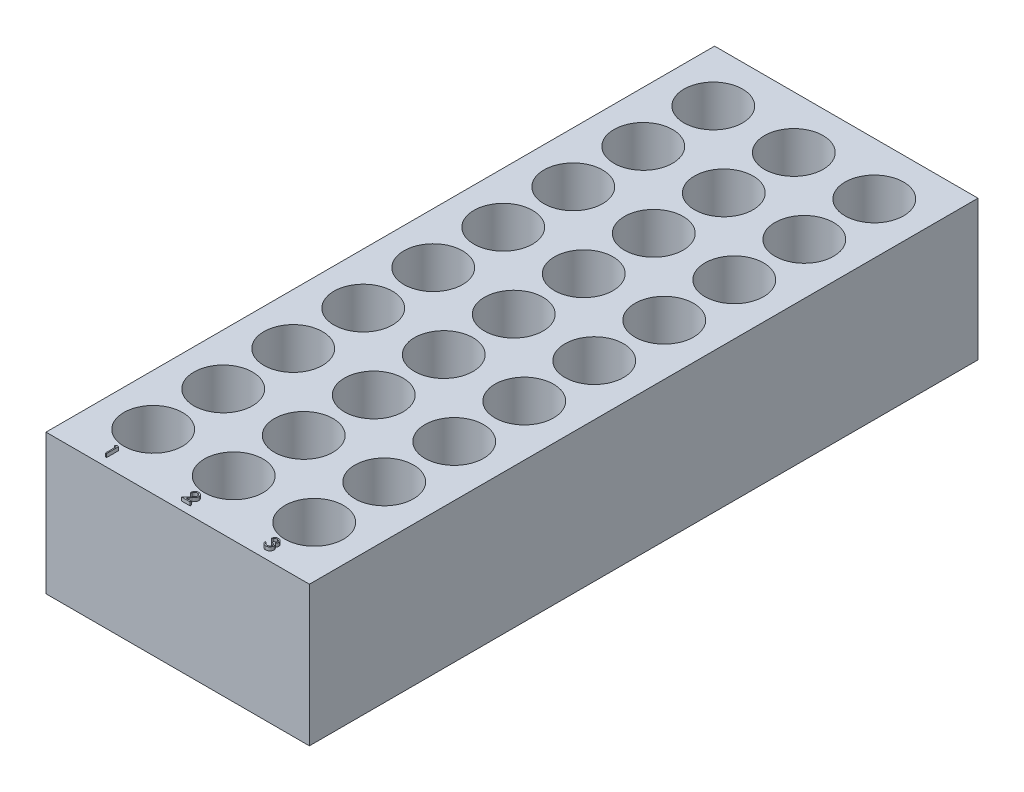
from build123d import *

# Parameters (mm, degrees)
SKETCH1_W           = 75.25
SKETCH1_H           = 191
SKETCH1_R           = 8.375
BOSS_EXTRUDE1_DEPTH = 30
SKETCH3_W           = 75.25
SKETCH3_H           = 191
BOSS_EXTRUDE2_DEPTH = 10
BOSS_EXTRUDE3_DEPTH = 1


with BuildPart() as part:
    # Sketch1 → Boss-Extrude1 (new body)
    with BuildSketch(Plane(origin=(0, 0, 0), x_dir=(1, 0, 0), z_dir=(0, 1, 0))):
        Rectangle(SKETCH1_W, SKETCH1_H)
        with Locations((-23, 80.5)):
            Circle(SKETCH1_R, mode=Mode.SUBTRACT)
        with Locations((0, 80.5)):
            Circle(SKETCH1_R, mode=Mode.SUBTRACT)
        with Locations((23, 80.5)):
            Circle(SKETCH1_R, mode=Mode.SUBTRACT)
        with Locations((-23, 60.5)):
            Circle(SKETCH1_R, mode=Mode.SUBTRACT)
        with Locations((0, 60.5)):
            Circle(SKETCH1_R, mode=Mode.SUBTRACT)
        with Locations((23, 60.5)):
            Circle(SKETCH1_R, mode=Mode.SUBTRACT)
        with Locations((-23, 40.5)):
            Circle(SKETCH1_R, mode=Mode.SUBTRACT)
        with Locations((0, 40.5)):
            Circle(SKETCH1_R, mode=Mode.SUBTRACT)
        with Locations((23, 40.5)):
            Circle(SKETCH1_R, mode=Mode.SUBTRACT)
        with Locations((-23, 20.5)):
            Circle(SKETCH1_R, mode=Mode.SUBTRACT)
        with Locations((0, 20.5)):
            Circle(SKETCH1_R, mode=Mode.SUBTRACT)
        with Locations((23, 20.5)):
            Circle(SKETCH1_R, mode=Mode.SUBTRACT)
        with Locations((-23, 0.5)):
            Circle(SKETCH1_R, mode=Mode.SUBTRACT)
        with Locations((0, 0.5)):
            Circle(SKETCH1_R, mode=Mode.SUBTRACT)
        with Locations((23, 0.5)):
            Circle(SKETCH1_R, mode=Mode.SUBTRACT)
        with Locations((-23, -19.5)):
            Circle(SKETCH1_R, mode=Mode.SUBTRACT)
        with Locations((0, -19.5)):
            Circle(SKETCH1_R, mode=Mode.SUBTRACT)
        with Locations((23, -19.5)):
            Circle(SKETCH1_R, mode=Mode.SUBTRACT)
        with Locations((-23, -39.5)):
            Circle(SKETCH1_R, mode=Mode.SUBTRACT)
        with Locations((0, -39.5)):
            Circle(SKETCH1_R, mode=Mode.SUBTRACT)
        with Locations((23, -39.5)):
            Circle(SKETCH1_R, mode=Mode.SUBTRACT)
        with Locations((-23, -59.5)):
            Circle(SKETCH1_R, mode=Mode.SUBTRACT)
        with Locations((0, -59.5)):
            Circle(SKETCH1_R, mode=Mode.SUBTRACT)
        with Locations((23, -59.5)):
            Circle(SKETCH1_R, mode=Mode.SUBTRACT)
        with Locations((-23, -79.5)):
            Circle(SKETCH1_R, mode=Mode.SUBTRACT)
        with Locations((0, -79.5)):
            Circle(SKETCH1_R, mode=Mode.SUBTRACT)
        with Locations((23, -79.5)):
            Circle(SKETCH1_R, mode=Mode.SUBTRACT)
    extrude(amount=BOSS_EXTRUDE1_DEPTH)

    # Sketch3 → Boss-Extrude2 (add)
    with BuildSketch(Plane.XZ):
        Rectangle(SKETCH3_W, SKETCH3_H)
    extrude(amount=BOSS_EXTRUDE2_DEPTH)

    # Sketch4 → Boss-Extrude3 (add)
    with BuildSketch(Plane(origin=(0, 30, 0), x_dir=(1, 0, 0), z_dir=(0, 1, 0))):
        Polygon((-23.314698, -89.675295836), (-22.667562584, -89.675295836), (-22.667562584, -93.175295836), (-22.981665148, -93.175295836), (-22.981665148, -90.034270195), (-23.520126686, -90.034270195), align=None)
        with BuildLine():
            Line((-0.725254891, -90.752218913), (-1.039357455, -90.752218913))
            add(Edge.make_bspline(
                [(-1.039357455, -90.752218913), (-1.037310302, -90.710548025), (-1.033289748, -90.628707511), (-1.014461459, -90.509383604), (-0.987520582, -90.395328805), (-0.949429128, -90.287458891), (-0.90212285, -90.184820084), (-0.845392823, -90.087820069), (-0.778198972, -89.99682888), (-0.701992238, -89.912690036), (-0.619223599, -89.835502466), (-0.52991766, -89.768847223), (-0.436072632, -89.712529552), (-0.337973233, -89.66544831), (-0.23451267, -89.630108464), (-0.126629812, -89.603886824), (-0.013850676, -89.588110478), (0.062989347, -89.586414693), (0.102068827, -89.585552246)],
                knots=[0, 0, 0, 0, 1.10065271, 2.161652631, 3.183658789, 4.190468796, 5.17591951, 6.163126047, 7.15150782, 8.156236427, 9.156009102, 10.134482811, 11.092018607, 12.041330605, 13.001268258, 13.972401359, 14.968799086, 16, 16, 16, 16], degree=3))
            add(Edge.make_bspline(
                [(0.102068827, -89.585552246), (0.140446901, -89.586450703), (0.215858445, -89.588216137), (0.32592046, -89.603377167), (0.430697754, -89.627122758), (0.529985521, -89.660438175), (0.622991585, -89.705222602), (0.71041463, -89.759020141), (0.793295441, -89.821239972), (0.867902224, -89.894493786), (0.936410304, -89.97269617), (0.995512559, -90.056184074), (1.046125722, -90.142413359), (1.088313402, -90.232041561), (1.119369541, -90.325912589), (1.142947749, -90.422659792), (1.156275163, -90.523284603), (1.158320586, -90.591391159), (1.159360493, -90.62601699)],
                knots=[0, 0, 0, 0, 1.111607364, 2.184268762, 3.212621178, 4.221274766, 5.211760367, 6.196651075, 7.1921475, 8.207485113, 9.220403448, 10.201281604, 11.166441695, 12.114753415, 13.065576456, 14.026450734, 14.996634279, 16, 16, 16, 16], degree=3))
            add(Edge.make_bspline(
                [(1.159360493, -90.62601699), (1.157667231, -90.674764824), (1.154310419, -90.771405038), (1.125596043, -90.913419901), (1.080749532, -91.05101332), (1.026752175, -91.161750622), (0.972279731, -91.250984116), (0.923192223, -91.324452821), (0.865727412, -91.403558289), (0.799048914, -91.488035626), (0.724536042, -91.578546531), (0.641513879, -91.675036327), (0.549390397, -91.776508097), (0.484731896, -91.845813698), (0.451227481, -91.881726124)],
                knots=[0, 0, 0, 0, 1.184426356, 2.348067706, 3.509069118, 4.696110526, 5.333549288, 6.050745305, 6.844228056, 7.710549037, 8.667450064, 9.695053472, 10.805634456, 12, 12, 12, 12], degree=3))
            Line((0.451227481, -91.881726124), (-0.424473641, -92.816321477))
            Line((-0.424473641, -92.816321477), (1.204232288, -92.816321477))
            Line((1.204232288, -92.816321477), (1.204232288, -93.175295836))
            Line((1.204232288, -93.175295836), (-1.17397284, -93.175295836))
            Line((-1.17397284, -93.175295836), (0.183398955, -91.726778208))
            add(Edge.make_bspline(
                [(0.183398955, -91.726778208), (0.216446842, -91.692279901), (0.279925069, -91.626015715), (0.369707646, -91.529272754), (0.450346634, -91.439523214), (0.522364027, -91.356936665), (0.584197532, -91.280305097), (0.639069764, -91.212110394), (0.683035355, -91.149355944), (0.730750751, -91.07661533), (0.776964732, -90.987803012), (0.816677088, -90.879269323), (0.840891937, -90.767542071), (0.843796772, -90.692040033), (0.845257929, -90.654061862)],
                knots=[0, 0, 0, 0, 1.329631726, 2.553950428, 3.673215718, 4.687767853, 5.603093632, 6.413772471, 7.123043292, 7.734684054, 8.834405432, 9.900288307, 10.943827018, 12, 12, 12, 12], degree=3))
            add(Edge.make_bspline(
                [(0.845257929, -90.654061862), (0.844622187, -90.630180463), (0.843369261, -90.583114813), (0.832311564, -90.514109054), (0.815601057, -90.44754424), (0.791655799, -90.383215621), (0.760049059, -90.321769969), (0.721575679, -90.263132489), (0.677185616, -90.206443523), (0.625834347, -90.153290225), (0.569422827, -90.10460902), (0.509828577, -90.061484934), (0.446778473, -90.025445824), (0.380538351, -89.995902326), (0.311292881, -89.972726945), (0.238908136, -89.956668366), (0.16358412, -89.946585882), (0.112150624, -89.94522171), (0.085943025, -89.944526605)],
                knots=[0, 0, 0, 0, 0.991446411, 1.95395049, 2.89581595, 3.838931463, 4.798493298, 5.75982156, 6.748411868, 7.785213223, 8.824556874, 9.840280684, 10.836137867, 11.835679398, 12.848801643, 13.863922112, 14.911575587, 16, 16, 16, 16], degree=3))
            add(Edge.make_bspline(
                [(0.085943025, -89.944526605), (0.058572193, -89.945241637), (0.004820396, -89.946645843), (-0.074098636, -89.956468507), (-0.149384414, -89.973414347), (-0.221226317, -89.996591022), (-0.289745903, -90.02604957), (-0.354609947, -90.062741315), (-0.415672836, -90.106524808), (-0.473049359, -90.156165364), (-0.525913338, -90.211432966), (-0.572360214, -90.273042929), (-0.612944228, -90.339870344), (-0.648353462, -90.411734895), (-0.677109152, -90.489288675), (-0.699082302, -90.57225638), (-0.716469149, -90.660277761), (-0.72227767, -90.721062846), (-0.725254891, -90.752218913)],
                knots=[0, 0, 0, 0, 1.031018746, 2.02475058, 2.990194455, 3.934040569, 4.864654155, 5.795059489, 6.735614925, 7.690564532, 8.649604399, 9.611025574, 10.590972636, 11.591080095, 12.624614302, 13.701020113, 14.821632451, 16, 16, 16, 16], degree=3))
        make_face()
        with BuildLine():
            Line((22.159360493, -90.482988144), (21.845257929, -90.482988144))
            add(Edge.make_bspline(
                [(21.845257929, -90.482988144), (21.85376748, -90.44775566), (21.870402956, -90.378879035), (21.905100529, -90.280471774), (21.942899784, -90.187348253), (21.988288889, -90.101252179), (22.037797643, -90.020453277), (22.094520365, -89.946784152), (22.155840087, -89.878371187), (22.223665036, -89.817657949), (22.294793698, -89.76268022), (22.370228318, -89.715805163), (22.448451211, -89.67548101), (22.530004344, -89.642260778), (22.615130516, -89.617235254), (22.703060139, -89.599078449), (22.79402364, -89.587287334), (22.85577123, -89.586136571), (22.887124916, -89.585552246)],
                knots=[0, 0, 0, 0, 1.162005537, 2.271625781, 3.343758855, 4.383309926, 5.390229558, 6.379919256, 7.361854164, 8.333198761, 9.295911338, 10.242430842, 11.177959212, 12.116337295, 13.062827104, 14.020064771, 14.994644689, 16, 16, 16, 16], degree=3))
            add(Edge.make_bspline(
                [(22.887124916, -89.585552246), (22.932807659, -89.586931476), (23.023176669, -89.589659852), (23.155939716, -89.614574288), (23.283966536, -89.653999421), (23.405855783, -89.708473148), (23.519074216, -89.775660461), (23.619810403, -89.855625198), (23.706698914, -89.946824499), (23.779593291, -90.047557064), (23.83666829, -90.155212573), (23.878754664, -90.26601273), (23.904376345, -90.379694702), (23.907696902, -90.456451981), (23.909360493, -90.494907214)],
                knots=[0, 0, 0, 0, 1.083050992, 2.142477498, 3.193116406, 4.255571735, 5.30263384, 6.308962982, 7.297363603, 8.282367274, 9.249857812, 10.179914175, 11.08814088, 12, 12, 12, 12], degree=3))
            add(Edge.make_bspline(
                [(23.909360493, -90.494907214), (23.908196902, -90.531914009), (23.905919935, -90.604330563), (23.88658623, -90.71005206), (23.854049967, -90.809693661), (23.808980204, -90.903674823), (23.750638654, -90.991399663), (23.679965957, -91.073065554), (23.596463295, -91.149034712), (23.533184357, -91.192554185), (23.500606487, -91.214959297)],
                knots=[0, 0, 0, 0, 1.024540389, 2.004866551, 2.965041327, 3.920577974, 4.882998113, 5.874504559, 6.905732034, 8, 8, 8, 8], degree=3))
            add(Edge.make_bspline(
                [(23.500606487, -91.214959297), (23.537838242, -91.232937469), (23.611605116, -91.268557427), (23.712155645, -91.338413184), (23.803433521, -91.419069532), (23.85433724, -91.482012184), (23.879913378, -91.513637182)],
                knots=[0, 0, 0, 0, 1.015518401, 2.012035669, 3.001164323, 4, 4, 4, 4], degree=3))
            add(Edge.make_bspline(
                [(23.879913378, -91.513637182), (23.89675472, -91.536694934), (23.930161616, -91.58243285), (23.97139715, -91.655969276), (24.008806264, -91.730320765), (24.037956484, -91.807480171), (24.060530351, -91.886553185), (24.076666383, -91.967675581), (24.086690524, -92.050913604), (24.088126076, -92.107226084), (24.088847673, -92.135532214)],
                knots=[0, 0, 0, 0, 1.025084078, 2.033381695, 3.024893161, 4.013698104, 4.991890475, 5.976764909, 6.982997093, 8, 8, 8, 8], degree=3))
            add(Edge.make_bspline(
                [(24.088847673, -92.135532214), (24.087053159, -92.184541935), (24.083472577, -92.282330737), (24.051468503, -92.426805459), (24.001855262, -92.568030961), (23.931398326, -92.7031058), (23.845530818, -92.829486181), (23.743373493, -92.94256249), (23.626087085, -93.039761095), (23.495281436, -93.120971323), (23.353564308, -93.185889245), (23.201988716, -93.230946688), (23.042738662, -93.260292687), (22.933531364, -93.263439556), (22.878010333, -93.265039426)],
                knots=[0, 0, 0, 0, 0.955779014, 1.907060117, 2.875433937, 3.871313158, 4.872415639, 5.851225146, 6.836215519, 7.83643374, 8.849228613, 9.86973379, 10.916971861, 12, 12, 12, 12], degree=3))
            add(Edge.make_bspline(
                [(22.878010333, -93.265039426), (22.840591033, -93.264171212), (22.766962328, -93.262462858), (22.658718829, -93.250784257), (22.55539713, -93.229454252), (22.456857532, -93.200750946), (22.363012496, -93.164359204), (22.274148391, -93.119040506), (22.189718497, -93.065729004), (22.110519546, -93.003795416), (22.036560978, -92.934514077), (21.969808254, -92.856655067), (21.909148461, -92.771657663), (21.856205822, -92.678534607), (21.80856887, -92.578489349), (21.769387913, -92.470240851), (21.734902344, -92.354756829), (21.71886888, -92.274279089), (21.710642545, -92.232988144)],
                knots=[0, 0, 0, 0, 1.048658725, 2.063410685, 3.046034179, 4.001477787, 4.936774919, 5.862367409, 6.792675028, 7.730719943, 8.675894397, 9.627829632, 10.600096036, 11.597688215, 12.626045268, 13.701542398, 14.82072376, 16, 16, 16, 16], degree=3))
            Line((21.710642545, -92.232988144), (22.024745109, -92.232988144))
            add(Edge.make_bspline(
                [(22.024745109, -92.232988144), (22.0329284, -92.259937157), (22.048845613, -92.312355329), (22.075939911, -92.387795634), (22.106808183, -92.456953687), (22.139922742, -92.520336809), (22.174701188, -92.578569212), (22.213616113, -92.630111081), (22.253785258, -92.677226283), (22.284064611, -92.703770895), (22.298883731, -92.716762182)],
                knots=[0, 0, 0, 0, 1.198163088, 2.33053128, 3.407730985, 4.417276592, 5.372219308, 6.28897303, 7.162600585, 8, 8, 8, 8], degree=3))
            add(Edge.make_bspline(
                [(22.298883731, -92.716762182), (22.318480307, -92.731870516), (22.35761297, -92.762040548), (22.421381201, -92.800542176), (22.488446087, -92.833903202), (22.560260761, -92.859386897), (22.635275532, -92.880964558), (22.714702897, -92.895085077), (22.797842114, -92.904773249), (22.854609878, -92.90562818), (22.883619308, -92.906065067)],
                knots=[0, 0, 0, 0, 0.946170439, 1.889420265, 2.845303464, 3.807233317, 4.801018734, 5.828864929, 6.890507805, 8, 8, 8, 8], degree=3))
            add(Edge.make_bspline(
                [(22.883619308, -92.906065067), (22.91637281, -92.905449161), (22.980419457, -92.904244812), (23.073874316, -92.893169105), (23.162781764, -92.877038692), (23.24615469, -92.852125709), (23.325085197, -92.821344857), (23.398466847, -92.782696452), (23.467262953, -92.73735173), (23.530592358, -92.685812572), (23.587537866, -92.629391077), (23.637677379, -92.570378005), (23.680302041, -92.509022176), (23.714685619, -92.444984055), (23.741836169, -92.378528826), (23.76031937, -92.309469997), (23.773170885, -92.238372731), (23.774217497, -92.190043762), (23.774745109, -92.165680451)],
                knots=[0, 0, 0, 0, 1.217147791, 2.380027433, 3.494444702, 4.572153297, 5.609568379, 6.639424714, 7.649109417, 8.668170816, 9.669597737, 10.625200337, 11.543417969, 12.441394052, 13.322311151, 14.205496177, 15.095365482, 16, 16, 16, 16], degree=3))
            add(Edge.make_bspline(
                [(23.774745109, -92.165680451), (23.773214807, -92.133069112), (23.770161819, -92.068008704), (23.746853239, -91.97229113), (23.708514375, -91.880067717), (23.654841864, -91.792911927), (23.589506135, -91.712136026), (23.513141228, -91.640064543), (23.425113, -91.580594452), (23.344093131, -91.539505796), (23.272327974, -91.511468721), (23.21091259, -91.492793756), (23.142155987, -91.476980101), (23.066889638, -91.462267829), (22.984546421, -91.449746481), (22.895215983, -91.439304665), (22.798880222, -91.430949624), (22.732189056, -91.427218529), (22.697822032, -91.425295836)],
                knots=[0, 0, 0, 0, 1.07054697, 2.135767047, 3.216561865, 4.33974944, 5.486079747, 6.621378074, 7.775625952, 8.963672916, 9.598146892, 10.304877434, 11.070270905, 11.915000392, 12.823868403, 13.805723172, 14.86925407, 16, 16, 16, 16], degree=3))
            Line((22.697822032, -91.425295836), (22.697822032, -91.066321477))
            add(Edge.make_bspline(
                [(22.697822032, -91.066321477), (22.741123198, -91.065586673), (22.825939544, -91.064147373), (22.949833849, -91.046739363), (23.068307161, -91.022658735), (23.178733903, -90.985773543), (23.279382616, -90.942933246), (23.366702218, -90.893081036), (23.439469366, -90.837666287), (23.497330437, -90.775833678), (23.540859666, -90.70951863), (23.572686463, -90.640401972), (23.59148679, -90.567877911), (23.593996456, -90.518383244), (23.595257929, -90.493504971)],
                knots=[0, 0, 0, 0, 1.321986639, 2.589447074, 3.816329219, 5.01088745, 6.139805852, 7.153945165, 8.075214402, 8.924034688, 9.728124013, 10.488707548, 11.240355623, 12, 12, 12, 12], degree=3))
            add(Edge.make_bspline(
                [(23.595257929, -90.493504971), (23.594843518, -90.475227225), (23.594019067, -90.438864518), (23.58362179, -90.38573945), (23.567997749, -90.334238504), (23.546518019, -90.284580693), (23.517767821, -90.23711042), (23.483361834, -90.191422971), (23.442393734, -90.147779192), (23.395448287, -90.107098872), (23.345036482, -90.068329635), (23.289786707, -90.035415998), (23.231364832, -90.007270936), (23.169706177, -89.984061434), (23.104610647, -89.966602146), (23.036384089, -89.954066304), (22.964896406, -89.946228649), (22.916124674, -89.945100233), (22.891331647, -89.944526605)],
                knots=[0, 0, 0, 0, 0.884392785, 1.759457502, 2.611959086, 3.489218968, 4.37281399, 5.2945488, 6.255912374, 7.266815255, 8.301784654, 9.332968512, 10.37626691, 11.440494194, 12.520033166, 13.637162961, 14.798855837, 16, 16, 16, 16], degree=3))
            add(Edge.make_bspline(
                [(22.891331647, -89.944526605), (22.851479979, -89.945917967), (22.773640403, -89.948635621), (22.661425486, -89.972438634), (22.557106152, -90.010416718), (22.477367485, -90.055749737), (22.418484911, -90.100500171), (22.376407973, -90.139582557), (22.335087463, -90.183015381), (22.297241786, -90.233473756), (22.258967809, -90.287540546), (22.224123248, -90.347964228), (22.190263555, -90.413168622), (22.169861006, -90.459264257), (22.159360493, -90.482988144)],
                knots=[0, 0, 0, 0, 1.472543308, 2.876219568, 4.221790263, 5.565193594, 6.249813518, 6.953379497, 7.687249741, 8.463570142, 9.283606569, 10.136032583, 11.040678096, 12, 12, 12, 12], degree=3))
        make_face()
    extrude(amount=BOSS_EXTRUDE3_DEPTH)


solid = part.part
